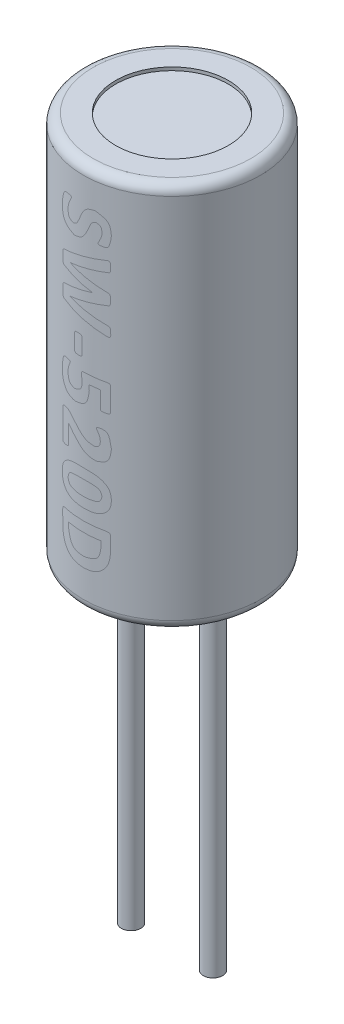
from build123d import *

# Parameters (mm, degrees)
SKETCH1_W           = 2.75
SKETCH1_H           = 12
SKETCH2_R           = 1.75
CUT_EXTRUDE1_DEPTH  = 0.1
CUT_EXTRUDE2_START  = -0.1
SKETCH3_R           = 1.75
CUT_EXTRUDE2_DEPTH  = 0.1
FILLET1_R           = 0.3
SKETCH4_R           = 0.3
BOSS_EXTRUDE1_DEPTH = 10.5
SKETCH5_W           = 2.5
SKETCH5_H           = 11


with BuildPart() as part:
    # Sketch1 → Revolve1 (revolve)
    with BuildSketch(Plane.XY):
        with Locations((1.375, 6)):
            Rectangle(SKETCH1_W, SKETCH1_H)
    revolve(axis=Axis((0, 0, 0), (0, 1, 0)))

    # Sketch2 → Cut-Extrude1 (cut)
    with BuildSketch(Plane(origin=(0, 12, 0), x_dir=(1, 0, 0), z_dir=(0, 1, 0))):
        Circle(SKETCH2_R)
    extrude(amount=-CUT_EXTRUDE1_DEPTH, mode=Mode.SUBTRACT)

    # Sketch3 → Cut-Extrude2 (cut)
    with BuildSketch(Plane.XZ.offset(CUT_EXTRUDE2_START)):
        Circle(SKETCH3_R)
    extrude(amount=CUT_EXTRUDE2_DEPTH, mode=Mode.SUBTRACT)

    # Fillet1
    fillet1_edges = [part.edges().sort_by_distance(p)[0] for p in [
        (-2.75, 0, 0),
        (-2.75, 12, 0),
    ]]
    fillet(fillet1_edges, radius=FILLET1_R)

    # Sketch4 → Boss-Extrude1 (add)
    with BuildSketch(Plane.XZ.offset(-0.1)):
        with Locations((1.27, 0)):
            Circle(SKETCH4_R)
        with Locations((-1.27, 0)):
            Circle(SKETCH4_R)
    extrude(amount=BOSS_EXTRUDE1_DEPTH)

    # Sketch5 → Cut-Revolve1 (revolve, cut)
    with BuildSketch(Plane.XY):
        with Locations((1.25, 6)):
            Rectangle(SKETCH5_W, SKETCH5_H)
    revolve(axis=Axis((0, 0.5, 0), (0, 1, 0)), mode=Mode.SUBTRACT)


solid = part.part
